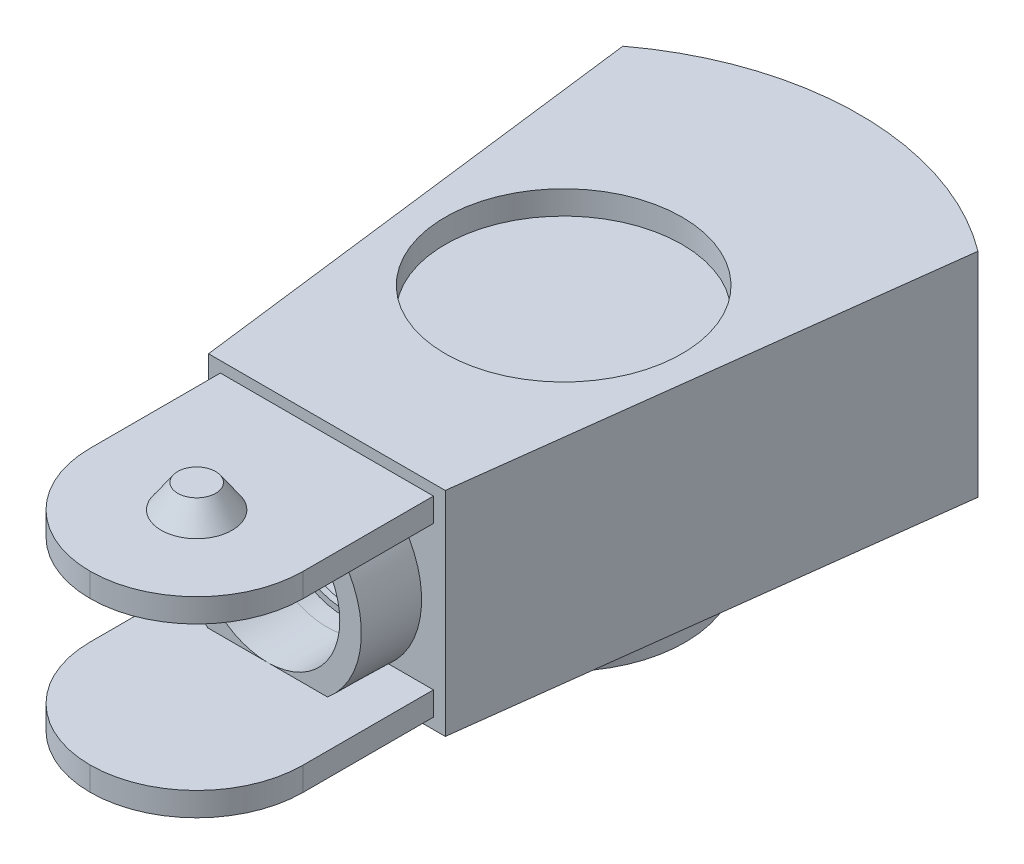
from build123d import *
from build123d.topology import SkipClean

# Parameters (mm, degrees)
BOSS_EXTRUDE1_DEPTH  = 2
BOSS_EXTRUDE2_DEPTH  = 14
BOSS_EXTRUDE3_DEPTH  = 2
SKETCH5_R            = 6
CUT_EXTRUDE1_DEPTH   = 2
SKETCH6_R            = 8
SKETCH6_R_2          = 6
EXTRUDE_THIN1_DEPTH  = 5
EXTRUDE_THIN1_DRAFT  = 1
BOSS_EXTRUDE4_START  = -0.5
SKETCH7_R            = 6
SKETCH7_R_2          = 5.5
BOSS_EXTRUDE4_DEPTH  = 0.5
SKETCH16_W           = 18
SKETCH16_H           = 2
BOSS_EXTRUDE8_DEPTH  = 20
FILLET1_R            = 9
SKETCH17_R           = 3
BOSS_EXTRUDE9_DEPTH  = 2
BOSS_EXTRUDE9_TAPER  = 35
FILLET1_OF_MIRROR2_R = 9
SKETCH8_R            = 10.25
BOSS_EXTRUDE10_DEPTH = 3
SKETCH18_R           = 8.25
CUT_EXTRUDE2_DEPTH   = 3
CUT_EXTRUDE3_REACH   = 53.875
SKETCH19_R           = 10
BOSS_EXTRUDE11_START = 1
BOSS_EXTRUDE11_DEPTH = 1


with BuildPart() as part:
    # Sketch2 → Boss-Extrude1 (new body)
    with BuildSketch(Plane(origin=(0, 0, 0), x_dir=(1, 0, 0), z_dir=(0, 1, 0))):
        with BuildLine():
            Line((-10, 0), (10, 0))
            Line((10, 0), (15, 40))
            ThreePointArc((15, 40), (0, 45), (-15, 40))
            Line((-15, 40), (-10, 0))
        make_face()
    extrude(amount=BOSS_EXTRUDE1_DEPTH)

    # Sketch3 → Boss-Extrude2 (add)
    with SkipClean():  # the faces are left unmerged after this step: merging them gives an invalid solid
        with BuildSketch(Plane(origin=(0, 2, 0), x_dir=(1, 0, 0), z_dir=(0, 1, 0))):
            with BuildLine():
                Line((-13.142759388, 41.266590598), (-8.234435563, 2))
                Line((-8.234435563, 2), (8.234435563, 2))
                Line((8.234435563, 2), (13.142759388, 41.266590598))
                ThreePointArc((13.142759388, 41.266590598), (14.085623501, 40.654181431), (15, 40))
                Line((15, 40), (10, 0))
                Line((10, 0), (-10, 0))
                Line((-10, 0), (-15, 40))
                ThreePointArc((-15, 40), (-14.085623501, 40.654181431), (-13.142759388, 41.266590598))
            make_face()
        extrude(amount=BOSS_EXTRUDE2_DEPTH)

    # Sketch4 → Boss-Extrude3 (add)
    with SkipClean():  # the faces are left unmerged after this step: merging them gives an invalid solid
        with BuildSketch(Plane(origin=(0, 16, 0), x_dir=(1, 0, 0), z_dir=(0, 1, 0))):
            with BuildLine():
                Line((-15, 40), (-10, 0))
                Line((-10, 0), (10, 0))
                Line((10, 0), (15, 40))
                ThreePointArc((15, 40), (0, 45), (-15, 40))
            make_face()
        extrude(amount=BOSS_EXTRUDE3_DEPTH)

    # Sketch5 → Cut-Extrude1 (cut)
    with SkipClean():  # the faces are left unmerged after this step: merging them gives an invalid solid
        with BuildSketch(Plane.XY):
            with Locations((0, 9)):
                Circle(SKETCH5_R)
        extrude(amount=-CUT_EXTRUDE1_DEPTH, mode=Mode.SUBTRACT)


with BuildPart() as extrude_thin1_tool:
    # Sketch6 → Extrude-Thin1 (with draft: the straight prism first)
    with BuildSketch(Plane.XY):
        with Locations((0, 9)):
            Circle(SKETCH6_R)
        with Locations((0, 9)):
            Circle(SKETCH6_R_2, mode=Mode.SUBTRACT)
    extrude(amount=EXTRUDE_THIN1_DEPTH)
    # Extrude-Thin1: the draft: its side faces are tilted about the plane it starts from
    extrude_thin1_sides = [extrude_thin1_tool.faces().sort_by_distance(p)[0] for p in [
        (-8, 9, 2.5),
        (-6, 9, 2.5),
    ]]
    draft(extrude_thin1_sides, Plane.XY, EXTRUDE_THIN1_DRAFT)


with BuildPart() as part_1:
    add(part.part)

    # Extrude-Thin1: add extrude_thin1_tool
    add(extrude_thin1_tool.part)

    # Sketch7 → Boss-Extrude4 (add)
    with SkipClean():  # the faces are left unmerged after this step: merging them gives an invalid solid
        with BuildSketch(Plane(origin=(0, 0, -2), x_dir=(-1, 0, 0), z_dir=(0, 0, -1)).offset(BOSS_EXTRUDE4_START)):
            with Locations(Location((0, 9, 0), (0, 0, 180))):
                Circle(SKETCH7_R)
            with Locations((0, 9)):
                Circle(SKETCH7_R_2, mode=Mode.SUBTRACT)
        extrude(amount=BOSS_EXTRUDE4_DEPTH)

    # Sketch16 → Boss-Extrude8 (add)
    with SkipClean():  # the faces are left unmerged after this step: merging them gives an invalid solid
        with BuildSketch(Plane.XY):
            with Locations((0, 1.912724675)):
                Rectangle(SKETCH16_W, SKETCH16_H)
        boss_extrude8 = extrude(amount=BOSS_EXTRUDE8_DEPTH)

    # Fillet1
    fillet1_edges = [part_1.edges().sort_by_distance(p)[0] for p in [
        (-9, 1.912724675, 20),
        (9, 1.912724675, 20),
    ]]
    fillet(fillet1_edges, radius=FILLET1_R - 0.0001)  # a hair under: the kernel refuses the full size

    # Sketch17 → Boss-Extrude9 (add)
    with BuildSketch(Plane.XZ.offset(-0.912724675)):
        with Locations((0, 11)):
            Circle(SKETCH17_R)
    boss_extrude9 = extrude(amount=BOSS_EXTRUDE9_DEPTH, taper=BOSS_EXTRUDE9_TAPER)

    # Mirror2: Boss-Extrude8, Boss-Extrude9 across plane
    add(boss_extrude8.mirror(Plane(origin=(0, 9, 0), x_dir=(0, 0, 1), z_dir=(0, -1, 0))))
    add(boss_extrude9.mirror(Plane(origin=(0, 9, 0), x_dir=(0, 0, 1), z_dir=(0, -1, 0))))

    # Fillet1 of Mirror2
    fillet1_of_mirror2_edges = [part_1.edges().sort_by_distance(p)[0] for p in [
        (-9, 16.087275325, 20),
        (9, 16.087275325, 20),
    ]]
    fillet(fillet1_of_mirror2_edges, radius=FILLET1_OF_MIRROR2_R - 0.0001)  # a hair under: the kernel refuses the full size

    # Sketch8 → Boss-Extrude10 (add)
    with BuildSketch(Plane(origin=(0, 0, 0), x_dir=(1, 0, 0), z_dir=(0, 1, 0))):
        with Locations(Location((0, 20, 0), (0, 0, 270))):
            Circle(SKETCH8_R)
    extrude(amount=-BOSS_EXTRUDE10_DEPTH)

    # Sketch18 → Cut-Extrude2 (cut)
    with BuildSketch(Plane(origin=(0, -3, 0), x_dir=(-1, 0, 0), z_dir=(0, -1, 0))):
        with Locations(Location((0, 20, 0), (0, 0, 90))):
            Circle(SKETCH18_R)
    extrude(amount=-CUT_EXTRUDE2_DEPTH, mode=Mode.SUBTRACT)

    # Sketch19 → Cut-Extrude3 (cut, up to next)
    with BuildSketch(Plane(origin=(0, 18, 0), x_dir=(1, 0, 0), z_dir=(0, 1, 0)), mode=Mode.PRIVATE) as cut_extrude3_sk1:
        with Locations(Location((0, 20, 0), (0, 0, 270))):
            Circle(SKETCH19_R)
    cut_extrude3_tool1 = extrude(cut_extrude3_sk1.sketch, amount=-CUT_EXTRUDE3_REACH, mode=Mode.PRIVATE) & part_1.part
    add(cut_extrude3_tool1.solids().sort_by_distance((0, 18, -20))[0], mode=Mode.SUBTRACT)

    # Sketch20 → Boss-Extrude11 (add)
    with BuildSketch(Plane.XZ.offset(-16).offset(BOSS_EXTRUDE11_START)):
        with BuildLine():
            Line((13.142759388, -41.266590598), (8.234435563, -2))
            Line((8.234435563, -2), (-8.234435563, -2))
            Line((-8.234435563, -2), (-13.142759388, -41.266590598))
            ThreePointArc((-13.142759388, -41.266590598), (0, -45), (13.142759388, -41.266590598))
        make_face()
    extrude(amount=-BOSS_EXTRUDE11_DEPTH)


solid = part_1.part
